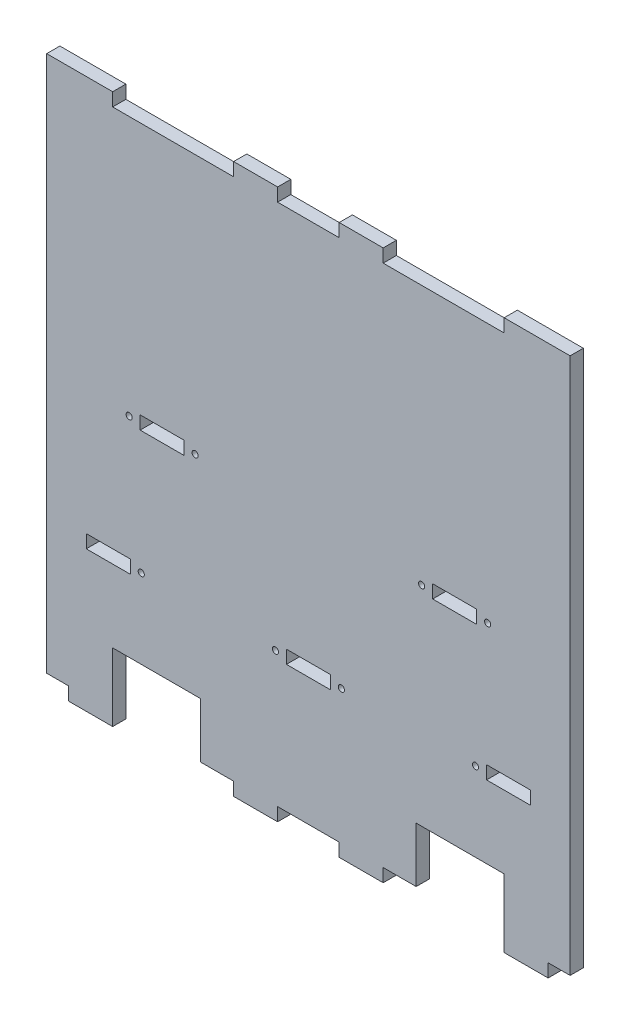
from build123d import *

# Parameters (mm, degrees)
ESQUISSE1_W             = 218
ESQUISSE1_H             = 238
ESQUISSE1_W_2           = 20
ESQUISSE1_H_2           = 6
BOSS_EXTRU_1_DEPTH      = 6
ESQUISSE2_W             = 40
ESQUISSE2_H             = 25
ENL_V_MAT_EXTRU_1_DEPTH = 6
ESQUISSE3_W             = 20
ESQUISSE3_H             = 6
BOSS_EXTRU_3_DEPTH      = 6
ESQUISSE4_R             = 1.4
ENL_V_MAT_EXTRU_2_DEPTH = 6
ESQUISSE5_W             = 10
ESQUISSE5_H             = 244
BOSS_EXTRU_4_DEPTH      = 6


with BuildPart() as part:
    # Esquisse1 → Boss.-Extru.1 (new body)
    with BuildSketch(Plane.XY):
        Rectangle(ESQUISSE1_W, ESQUISSE1_H)
        with Locations((-91, -58)):
            Rectangle(ESQUISSE1_W_2, ESQUISSE1_H_2, mode=Mode.SUBTRACT)
        with Locations((0, -58)):
            Rectangle(ESQUISSE1_W_2, ESQUISSE1_H_2, mode=Mode.SUBTRACT)
        with Locations((91, -58)):
            Rectangle(ESQUISSE1_W_2, ESQUISSE1_H_2, mode=Mode.SUBTRACT)
        with Locations((-66.5, 1)):
            Rectangle(ESQUISSE1_W_2, ESQUISSE1_H_2, mode=Mode.SUBTRACT)
        with Locations((66.5, 1)):
            Rectangle(ESQUISSE1_W_2, ESQUISSE1_H_2, mode=Mode.SUBTRACT)
    extrude(amount=BOSS_EXTRU_1_DEPTH)

    # Esquisse2 → Enlèv. mat.-Extru.1 (cut)
    with BuildSketch(Plane.XY.offset(6)):
        with Locations((-69, -106.5)):
            Rectangle(ESQUISSE2_W, ESQUISSE2_H)
        with Locations((69, -106.5)):
            Rectangle(ESQUISSE2_W, ESQUISSE2_H)
    extrude(amount=-ENL_V_MAT_EXTRU_1_DEPTH, mode=Mode.SUBTRACT)

    # Esquisse3 → Boss.-Extru.3 (add)
    with BuildSketch(Plane.XY.offset(6)):
        with Locations((-99, -122)):
            Rectangle(ESQUISSE3_W, ESQUISSE3_H)
        with Locations((-24, -122)):
            Rectangle(ESQUISSE3_W, ESQUISSE3_H)
        with Locations((99, -122)):
            Rectangle(ESQUISSE3_W, ESQUISSE3_H)
        with Locations((24, -122)):
            Rectangle(ESQUISSE3_W, ESQUISSE3_H)
        with Locations((24, 122)):
            Rectangle(ESQUISSE3_W, ESQUISSE3_H)
        with Locations((99, 122)):
            Rectangle(ESQUISSE3_W, ESQUISSE3_H)
        with Locations((-24, 122)):
            Rectangle(ESQUISSE3_W, ESQUISSE3_H)
        with Locations((-99, 122)):
            Rectangle(ESQUISSE3_W, ESQUISSE3_H)
    extrude(amount=-BOSS_EXTRU_3_DEPTH)

    # Esquisse4 → Enlèv. mat.-Extru.2 (cut)
    with BuildSketch(Plane.XY.offset(6)):
        with Locations((-15, -58)):
            Circle(ESQUISSE4_R)
        with Locations((-76, -58)):
            Circle(ESQUISSE4_R)
        with Locations((51.5, 1)):
            Circle(ESQUISSE4_R)
        with Locations((81.5, 1)):
            Circle(ESQUISSE4_R)
        with Locations((76, -58)):
            Circle(ESQUISSE4_R)
        with Locations((15, -58)):
            Circle(ESQUISSE4_R)
        with Locations((-81.5, 1)):
            Circle(ESQUISSE4_R)
        with Locations((-51.5, 1)):
            Circle(ESQUISSE4_R)
    extrude(amount=-ENL_V_MAT_EXTRU_2_DEPTH, mode=Mode.SUBTRACT)

    # Esquisse5 → Boss.-Extru.4 (add)
    with BuildSketch(Plane.XY.offset(6)):
        with Locations((-114, 3)):
            Rectangle(ESQUISSE5_W, ESQUISSE5_H)
        with Locations((114, 3)):
            Rectangle(ESQUISSE5_W, ESQUISSE5_H)
    extrude(amount=-BOSS_EXTRU_4_DEPTH)


solid = part.part
